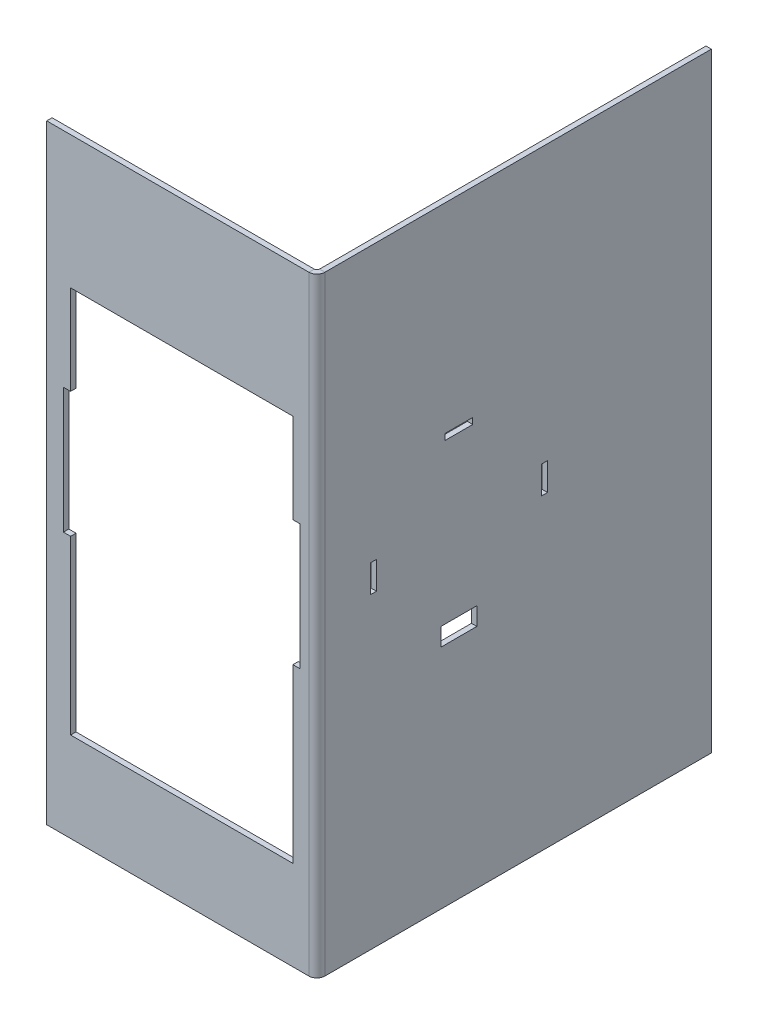
from build123d import *

# Parameters (mm, degrees)
SKETCH1_W                    = 75.36
SKETCH1_H                    = 170
BASE_FLANGE1_DEPTH           = 1.5
EDGE_FLANGE1_STRIP_W         = 7.4732
EDGE_FLANGE1_STRIP_H         = 1.5
EDGE_FLANGE1_STRIP_CUT_DEPTH = 170
EDGE_FLANGE1_DEPTH           = 170
SKETCH11_W                   = 1.7
SKETCH11_H                   = 7.7
SKETCH11_W_2                 = 7.7
SKETCH11_H_2                 = 1.7
SKETCH11_W_3                 = 10
SKETCH11_H_3                 = 5
CUT_EXTRUDE2_DEPTH           = 2


# Sheet-metal steps are written as plain solids
with BuildPart() as part:
    # Sketch1 → Base-Flange1 (new body)
    with BuildSketch(Plane.XY):
        Rectangle(SKETCH1_W, SKETCH1_H)
        Polygon((-31, 23), (-31, 48), (31, 48), (31, 23), (33, 23), (33, -12), (31, -12), (31, -60), (-31, -60), (-31, -12), (-33, -12), (-33, 23), align=None, mode=Mode.SUBTRACT)
    extrude(amount=-BASE_FLANGE1_DEPTH)

    # Edge-Flange1 strip (across the edge) → Edge-Flange1 strip cut (cut)
    with BuildSketch(Plane(origin=(37.68, 85, -1.5), x_dir=(-1, 0, 0), z_dir=(0, -1, 0))):
        with Locations((-1.5, -0.75)):
            Rectangle(EDGE_FLANGE1_STRIP_W, EDGE_FLANGE1_STRIP_H)
    extrude(amount=EDGE_FLANGE1_STRIP_CUT_DEPTH, mode=Mode.SUBTRACT)

    # Edge-Flange1 section (across the edge) → Edge-Flange1 (add)
    with BuildSketch(Plane(origin=(37.68, 85, -1.5), x_dir=(-1, 0, 0), z_dir=(0, -1, 0))):
        with BuildLine():
            Line((0, 0.7366), (0, 108.5))
            Line((0, 108.5), (1.5, 108.5))
            Line((1.5, 108.5), (1.5, 0.7366))
            ThreePointArc((1.5, 0.7366), (1.715745145, 0.215745145), (2.2366, 0))
            Line((2.2366, 0), (2.2366, -1.5))
            ThreePointArc((2.2366, -1.5), (0.655084973, -0.844915027), (0, 0.7366))
        make_face()
    extrude(amount=EDGE_FLANGE1_DEPTH)

    # Sketch11 → Cut-Extrude2 (cut)
    with BuildSketch(Plane(origin=(37.68, 0, 0), x_dir=(0, 0, -1), z_dir=(1, 0, 0))):
        with Locations((63.463831766, 4.61334704)):
            Rectangle(SKETCH11_W, SKETCH11_H)
        with Locations((39.613831766, 28.46334704)):
            Rectangle(SKETCH11_W_2, SKETCH11_H_2)
        with Locations((15.763831766, 4.61334704)):
            Rectangle(SKETCH11_W, SKETCH11_H)
        with Locations((39.613831766, -19.23665296)):
            Rectangle(SKETCH11_W_3, SKETCH11_H_3)
    extrude(amount=-CUT_EXTRUDE2_DEPTH, mode=Mode.SUBTRACT)


solid = part.part
